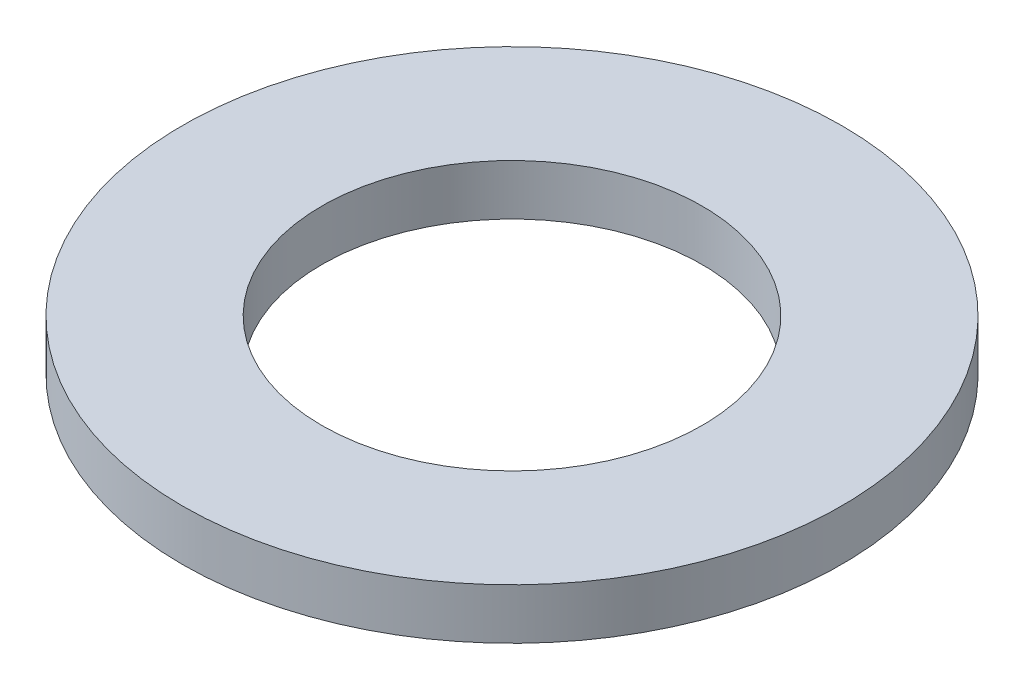
from build123d import *

# Parameters (mm, degrees)
SKETCH1_R           = 65
BOSS_EXTRUDE1_DEPTH = 10
SKETCH2_R           = 37.5
CUT_EXTRUDE1_DEPTH  = 93.466210045


with BuildPart() as part:
    # Sketch1 → Boss-Extrude1 (new body)
    with BuildSketch(Plane(origin=(0, 0, 0), x_dir=(1, 0, 0), z_dir=(0, 1, 0))):
        Circle(SKETCH1_R)
    extrude(amount=BOSS_EXTRUDE1_DEPTH)

    # Sketch2 → Cut-Extrude1 (cut, through all)
    with BuildSketch(Plane(origin=(0, 0, 0), x_dir=(1, 0, 0), z_dir=(0, 1, 0))):
        Circle(SKETCH2_R)
    extrude(amount=CUT_EXTRUDE1_DEPTH, mode=Mode.SUBTRACT)


solid = part.part
